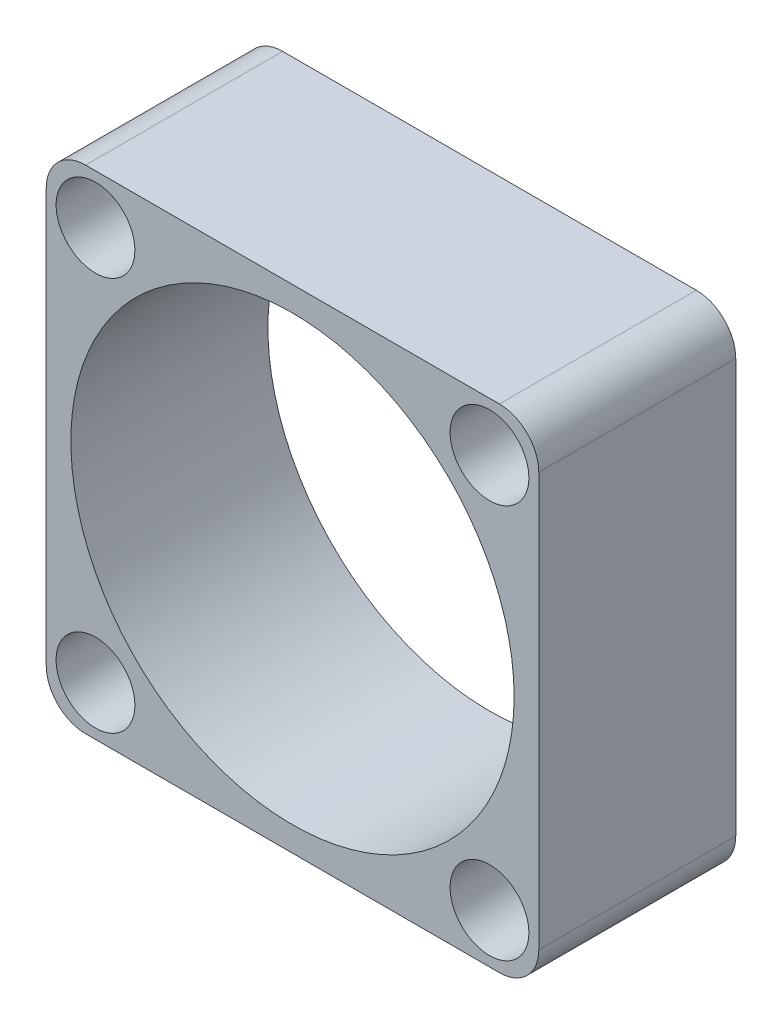
from build123d import *

# Parameters (mm, degrees)
SKETCH1_W           = 25
SKETCH1_H           = 25
BOSS_EXTRUDE1_DEPTH = 10
SKETCH3_R           = 11.25
SKETCH3_R_2         = 2
CUT_EXTRUDE1_DEPTH  = 10
FILLET1_R           = 2


with BuildPart() as part:
    # Sketch1 → Boss-Extrude1 (new body)
    with BuildSketch(Plane.XY):
        with Locations((12.5, 12.5)):
            Rectangle(SKETCH1_W, SKETCH1_H)
    extrude(amount=BOSS_EXTRUDE1_DEPTH)

    # Sketch3 → Cut-Extrude1 (cut)
    with BuildSketch(Plane.XY.offset(10)):
        with Locations((12.5, 12.5)):
            Circle(SKETCH3_R)
        with Locations((2.5, 22.5)):
            Circle(SKETCH3_R_2)
        with Locations((22.5, 22.5)):
            Circle(SKETCH3_R_2)
        with Locations((22.5, 2.5)):
            Circle(SKETCH3_R_2)
        with Locations((2.5, 2.5)):
            Circle(SKETCH3_R_2)
    extrude(amount=-CUT_EXTRUDE1_DEPTH, mode=Mode.SUBTRACT)

    # Fillet1
    fillet1_edges = [part.edges().sort_by_distance(p)[0] for p in [
        (0, 0, 5),
        (25, 0, 5),
        (0, 25, 5),
        (25, 25, 5),
    ]]
    fillet(fillet1_edges, radius=FILLET1_R)


solid = part.part
